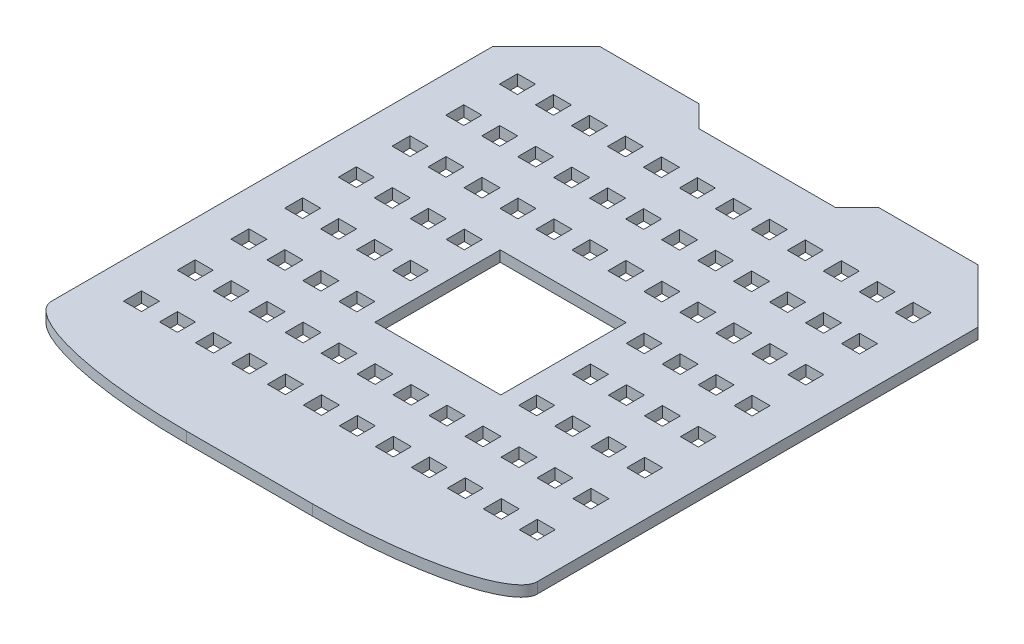
from build123d import *

# Parameters (mm, degrees)
SKETCH1_W           = 135
SKETCH1_H           = 150
BOSS_EXTRUDE1_DEPTH = 3
SKETCH2_W           = 5
SKETCH2_H           = 5
CUT_EXTRUDE1_DEPTH  = 101.94676815
FILLET1_SIZE        = 12.5
FILLET1_SIZE_2      = 50
FILLET2_SIZE        = 12.5
FILLET2_SIZE_2      = 50
CUT_EXTRUDE2_DEPTH  = 101.946768294
CUT_EXTRUDE3_DEPTH  = 101.946768294
SKETCH6_W           = 35
SKETCH6_H           = 34.857142857
CUT_EXTRUDE4_DEPTH  = 101.946768294


with BuildPart() as part:
    # Sketch1 → Boss-Extrude1 (new body)
    with BuildSketch(Plane(origin=(0, 0, 0), x_dir=(1, 0, 0), z_dir=(0, 1, 0))):
        Rectangle(SKETCH1_W, SKETCH1_H)
    extrude(amount=BOSS_EXTRUDE1_DEPTH)

    # Sketch2 → Cut-Extrude1 (cut, through all)
    with BuildSketch(Plane(origin=(0, 3, 0), x_dir=(1, 0, 0), z_dir=(0, 1, 0))):
        with Locations((-55, 54.5)):
            Rectangle(SKETCH2_W, SKETCH2_H)
        with Locations((-45, 54.5)):
            Rectangle(SKETCH2_W, SKETCH2_H)
        with Locations((-35, 54.5)):
            Rectangle(SKETCH2_W, SKETCH2_H)
        with Locations((-25, 54.5)):
            Rectangle(SKETCH2_W, SKETCH2_H)
        with Locations((-15, 54.5)):
            Rectangle(SKETCH2_W, SKETCH2_H)
        with Locations((-5, 54.5)):
            Rectangle(SKETCH2_W, SKETCH2_H)
        with Locations((5, 54.5)):
            Rectangle(SKETCH2_W, SKETCH2_H)
        with Locations((15, 54.5)):
            Rectangle(SKETCH2_W, SKETCH2_H)
        with Locations((25, 54.5)):
            Rectangle(SKETCH2_W, SKETCH2_H)
        with Locations((35, 54.5)):
            Rectangle(SKETCH2_W, SKETCH2_H)
        with Locations((45, 54.5)):
            Rectangle(SKETCH2_W, SKETCH2_H)
        with Locations((55, 54.5)):
            Rectangle(SKETCH2_W, SKETCH2_H)
        with Locations((-45, 39.571428571)):
            Rectangle(SKETCH2_W, SKETCH2_H)
        with Locations((-35, 39.571428571)):
            Rectangle(SKETCH2_W, SKETCH2_H)
        with Locations((-25, 39.571428571)):
            Rectangle(SKETCH2_W, SKETCH2_H)
        with Locations((-15, 39.571428571)):
            Rectangle(SKETCH2_W, SKETCH2_H)
        with Locations((-5, 39.571428571)):
            Rectangle(SKETCH2_W, SKETCH2_H)
        with Locations((5, 39.571428571)):
            Rectangle(SKETCH2_W, SKETCH2_H)
        with Locations((15, 39.571428571)):
            Rectangle(SKETCH2_W, SKETCH2_H)
        with Locations((25, 39.571428571)):
            Rectangle(SKETCH2_W, SKETCH2_H)
        with Locations((35, 39.571428571)):
            Rectangle(SKETCH2_W, SKETCH2_H)
        with Locations((45, 39.571428571)):
            Rectangle(SKETCH2_W, SKETCH2_H)
        with Locations((55, 39.571428571)):
            Rectangle(SKETCH2_W, SKETCH2_H)
        with Locations((-45, 24.642857143)):
            Rectangle(SKETCH2_W, SKETCH2_H)
        with Locations((-35, 24.642857143)):
            Rectangle(SKETCH2_W, SKETCH2_H)
        with Locations((-25, 24.642857143)):
            Rectangle(SKETCH2_W, SKETCH2_H)
        with Locations((-15, 24.642857143)):
            Rectangle(SKETCH2_W, SKETCH2_H)
        with Locations((-5, 24.642857143)):
            Rectangle(SKETCH2_W, SKETCH2_H)
        with Locations((5, 24.642857143)):
            Rectangle(SKETCH2_W, SKETCH2_H)
        with Locations((15, 24.642857143)):
            Rectangle(SKETCH2_W, SKETCH2_H)
        with Locations((25, 24.642857143)):
            Rectangle(SKETCH2_W, SKETCH2_H)
        with Locations((35, 24.642857143)):
            Rectangle(SKETCH2_W, SKETCH2_H)
        with Locations((45, 24.642857143)):
            Rectangle(SKETCH2_W, SKETCH2_H)
        with Locations((55, 24.642857143)):
            Rectangle(SKETCH2_W, SKETCH2_H)
        with Locations((-45, 9.714285714)):
            Rectangle(SKETCH2_W, SKETCH2_H)
        with Locations((-35, 9.714285714)):
            Rectangle(SKETCH2_W, SKETCH2_H)
        with Locations((-25, 9.714285714)):
            Rectangle(SKETCH2_W, SKETCH2_H)
        with Locations((-15, 9.714285714)):
            Rectangle(SKETCH2_W, SKETCH2_H)
        with Locations((-5, 9.714285714)):
            Rectangle(SKETCH2_W, SKETCH2_H)
        with Locations((5, 9.714285714)):
            Rectangle(SKETCH2_W, SKETCH2_H)
        with Locations((15, 9.714285714)):
            Rectangle(SKETCH2_W, SKETCH2_H)
        with Locations((25, 9.714285714)):
            Rectangle(SKETCH2_W, SKETCH2_H)
        with Locations((35, 9.714285714)):
            Rectangle(SKETCH2_W, SKETCH2_H)
        with Locations((45, 9.714285714)):
            Rectangle(SKETCH2_W, SKETCH2_H)
        with Locations((55, 9.714285714)):
            Rectangle(SKETCH2_W, SKETCH2_H)
        with Locations((-45, -5.214285714)):
            Rectangle(SKETCH2_W, SKETCH2_H)
        with Locations((-35, -5.214285714)):
            Rectangle(SKETCH2_W, SKETCH2_H)
        with Locations((-25, -5.214285714)):
            Rectangle(SKETCH2_W, SKETCH2_H)
        with Locations((-15, -5.214285714)):
            Rectangle(SKETCH2_W, SKETCH2_H)
        with Locations((-5, -5.214285714)):
            Rectangle(SKETCH2_W, SKETCH2_H)
        with Locations((5, -5.214285714)):
            Rectangle(SKETCH2_W, SKETCH2_H)
        with Locations((15, -5.214285714)):
            Rectangle(SKETCH2_W, SKETCH2_H)
        with Locations((25, -5.214285714)):
            Rectangle(SKETCH2_W, SKETCH2_H)
        with Locations((35, -5.214285714)):
            Rectangle(SKETCH2_W, SKETCH2_H)
        with Locations((45, -5.214285714)):
            Rectangle(SKETCH2_W, SKETCH2_H)
        with Locations((55, -5.214285714)):
            Rectangle(SKETCH2_W, SKETCH2_H)
        with Locations((-45, -20.142857143)):
            Rectangle(SKETCH2_W, SKETCH2_H)
        with Locations((-35, -20.142857143)):
            Rectangle(SKETCH2_W, SKETCH2_H)
        with Locations((-25, -20.142857143)):
            Rectangle(SKETCH2_W, SKETCH2_H)
        with Locations((-15, -20.142857143)):
            Rectangle(SKETCH2_W, SKETCH2_H)
        with Locations((-5, -20.142857143)):
            Rectangle(SKETCH2_W, SKETCH2_H)
        with Locations((5, -20.142857143)):
            Rectangle(SKETCH2_W, SKETCH2_H)
        with Locations((15, -20.142857143)):
            Rectangle(SKETCH2_W, SKETCH2_H)
        with Locations((25, -20.142857143)):
            Rectangle(SKETCH2_W, SKETCH2_H)
        with Locations((35, -20.142857143)):
            Rectangle(SKETCH2_W, SKETCH2_H)
        with Locations((45, -20.142857143)):
            Rectangle(SKETCH2_W, SKETCH2_H)
        with Locations((55, -20.142857143)):
            Rectangle(SKETCH2_W, SKETCH2_H)
        with Locations((-45, -35.071428571)):
            Rectangle(SKETCH2_W, SKETCH2_H)
        with Locations((-35, -35.071428571)):
            Rectangle(SKETCH2_W, SKETCH2_H)
        with Locations((-25, -35.071428571)):
            Rectangle(SKETCH2_W, SKETCH2_H)
        with Locations((-15, -35.071428571)):
            Rectangle(SKETCH2_W, SKETCH2_H)
        with Locations((-5, -35.071428571)):
            Rectangle(SKETCH2_W, SKETCH2_H)
        with Locations((5, -35.071428571)):
            Rectangle(SKETCH2_W, SKETCH2_H)
        with Locations((15, -35.071428571)):
            Rectangle(SKETCH2_W, SKETCH2_H)
        with Locations((25, -35.071428571)):
            Rectangle(SKETCH2_W, SKETCH2_H)
        with Locations((35, -35.071428571)):
            Rectangle(SKETCH2_W, SKETCH2_H)
        with Locations((45, -35.071428571)):
            Rectangle(SKETCH2_W, SKETCH2_H)
        with Locations((55, -35.071428571)):
            Rectangle(SKETCH2_W, SKETCH2_H)
        with Locations((-45, -50)):
            Rectangle(SKETCH2_W, SKETCH2_H)
        with Locations((-35, -50)):
            Rectangle(SKETCH2_W, SKETCH2_H)
        with Locations((-25, -50)):
            Rectangle(SKETCH2_W, SKETCH2_H)
        with Locations((-15, -50)):
            Rectangle(SKETCH2_W, SKETCH2_H)
        with Locations((-5, -50)):
            Rectangle(SKETCH2_W, SKETCH2_H)
        with Locations((5, -50)):
            Rectangle(SKETCH2_W, SKETCH2_H)
        with Locations((15, -50)):
            Rectangle(SKETCH2_W, SKETCH2_H)
        with Locations((25, -50)):
            Rectangle(SKETCH2_W, SKETCH2_H)
        with Locations((35, -50)):
            Rectangle(SKETCH2_W, SKETCH2_H)
        with Locations((45, -50)):
            Rectangle(SKETCH2_W, SKETCH2_H)
        with Locations((55, -50)):
            Rectangle(SKETCH2_W, SKETCH2_H)
        with Locations((-55, 39.571428571)):
            Rectangle(SKETCH2_W, SKETCH2_H)
        with Locations((-55, 24.642857143)):
            Rectangle(SKETCH2_W, SKETCH2_H)
        with Locations((-55, 9.714285714)):
            Rectangle(SKETCH2_W, SKETCH2_H)
        with Locations((-55, -5.214285714)):
            Rectangle(SKETCH2_W, SKETCH2_H)
        with Locations((-55, -20.142857143)):
            Rectangle(SKETCH2_W, SKETCH2_H)
        with Locations((-55, -35.071428571)):
            Rectangle(SKETCH2_W, SKETCH2_H)
        with Locations((-55, -50)):
            Rectangle(SKETCH2_W, SKETCH2_H)
    extrude(amount=-CUT_EXTRUDE1_DEPTH, mode=Mode.SUBTRACT)

    # Fillet1
    # an asymmetric fillet: 50, 12.5 mm, written as the material it takes off along each edge
    with BuildSketch(Plane(origin=(-67.5, -125, 75), x_dir=(0, 0, -1), z_dir=(0, 1, 0))) as fillet1_piece_1:
        with BuildLine():
            Bezier((FILLET1_SIZE, 0), (0, 0), (0, -FILLET1_SIZE_2), weights=[1, 0.707106781, 1])
            Line((0, -FILLET1_SIZE_2), (0, 0))
            Line((0, 0), (FILLET1_SIZE, 0))
        make_face()
    extrude(amount=253, mode=Mode.SUBTRACT)

    # Fillet2
    # an asymmetric fillet: 50, 12.5 mm, written as the material it takes off along each edge
    with BuildSketch(Plane(origin=(67.5, -125, 75), x_dir=(0, 0, -1), z_dir=(0, 1, 0))) as fillet2_piece_1:
        with BuildLine():
            Bezier((FILLET2_SIZE, 0), (0, 0), (0, FILLET2_SIZE_2), weights=[1, 0.707106781, 1])
            Line((0, FILLET2_SIZE_2), (0, 0))
            Line((0, 0), (FILLET2_SIZE, 0))
        make_face()
    extrude(amount=253, mode=Mode.SUBTRACT)

    # Sketch4 → Cut-Extrude2 (cut, through all)
    with BuildSketch(Plane(origin=(0, 3, 0), x_dir=(1, 0, 0), z_dir=(0, 1, 0))):
        Polygon((-67.5, 60), (-67.5, 75), (-52.5, 75), align=None)
        Polygon((67.5, 75), (52.5, 75), (67.5, 60), align=None)
    extrude(amount=-CUT_EXTRUDE2_DEPTH, mode=Mode.SUBTRACT)

    # Sketch5 → Cut-Extrude3 (cut, through all)
    with BuildSketch(Plane(origin=(0, 3, 0), x_dir=(1, 0, 0), z_dir=(0, 1, 0))):
        Polygon((-25, 75), (25, 75), (19, 69), (-19, 69), align=None)
    extrude(amount=-CUT_EXTRUDE3_DEPTH, mode=Mode.SUBTRACT)

    # Sketch6 → Cut-Extrude4 (cut, through all)
    with BuildSketch(Plane(origin=(0, 3, 0), x_dir=(1, 0, 0), z_dir=(0, 1, 0))):
        with Locations((0, -5.214285714)):
            Rectangle(SKETCH6_W, SKETCH6_H)
    extrude(amount=-CUT_EXTRUDE4_DEPTH, mode=Mode.SUBTRACT)


solid = part.part
